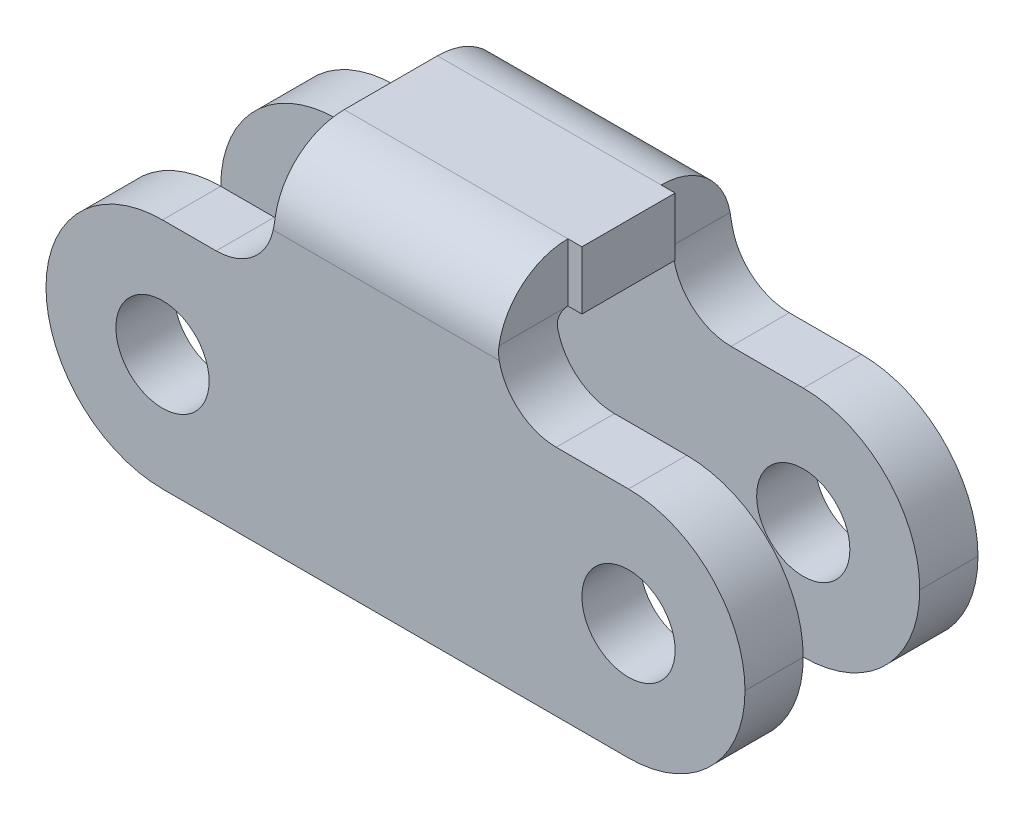
from build123d import *

# Parameters (mm, degrees)
SKETCH1_W           = 38.1
SKETCH1_H           = 19.05
SKETCH1_R           = 2.54
BASE_EXTRUDE_DEPTH  = 12.7
CUT_EXTRUDE1_DEPTH  = 43.121134838
CUT_EXTRUDE2_DEPTH  = 37.477972806
CUT_EXTRUDE3_DEPTH  = 37.477972806
FILLET1_R           = 0.635
FILLET2_R           = 3.81
FILLET3_R           = 6.35
SKETCH6_W           = 5.08
SKETCH6_H           = 3.175
BOSS_EXTRUDE1_DEPTH = 0.762


# Some blends are built 0.0001 mm under size
with BuildPart() as part:
    # Sketch1 → Base-Extrude (new body)
    with BuildSketch(Plane.XY):
        with Locations((12.7, 3.175)):
            Rectangle(SKETCH1_W, SKETCH1_H)
        Circle(SKETCH1_R, mode=Mode.SUBTRACT)
        with Locations((25.4, 0)):
            Circle(SKETCH1_R, mode=Mode.SUBTRACT)
    extrude(amount=-BASE_EXTRUDE_DEPTH)

    # Sketch3 → Cut-Extrude1 (cut, through all)
    with BuildSketch(Plane(origin=(31.75, 0, 0), x_dir=(0, 0, -1), z_dir=(1, 0, 0))):
        Polygon((3.175, -58.947094971), (3.175, -6.35), (3.175, 9.525), (9.525, 9.525), (9.525, -6.35), (9.525, -58.947094971), (9.525, -164.141284914), (3.175, -164.141284914), align=None)
    extrude(amount=-CUT_EXTRUDE1_DEPTH, mode=Mode.SUBTRACT)

    # Sketch4 → Cut-Extrude2 (cut, through all)
    with BuildSketch(Plane.XY):
        with BuildLine():
            Line((-96.671852568, 6.35), (-6.35, 6.35))
            Line((-6.35, 6.35), (2.921, 6.35))
            ThreePointArc((2.921, 6.35), (5.16606403, 7.27993597), (6.096, 9.525))
            Line((6.096, 9.525), (6.096, 12.7))
            Line((6.096, 12.7), (6.096, 103.021852568))
            Line((6.096, 103.021852568), (-117.676302849, 234.599074203))
            Line((-117.676302849, 234.599074203), (-220.444155417, 137.927221634))
            Line((-220.444155417, 137.927221634), (-96.671852568, 6.35))
        make_face()
    extrude(amount=-CUT_EXTRUDE2_DEPTH, mode=Mode.SUBTRACT)

    # Sketch5 → Cut-Extrude3 (cut, through all)
    with BuildSketch(Plane.XY):
        with BuildLine():
            Line((122.071852568, 6.35), (31.75, 6.35))
            Line((31.75, 6.35), (21.463, 6.35))
            ThreePointArc((21.463, 6.35), (19.21793597, 7.27993597), (18.288, 9.525))
            Line((18.288, 9.525), (18.288, 12.7))
            Line((18.288, 12.7), (18.288, 103.021852568))
            Line((18.288, 103.021852568), (141.41301137, 235.20498228))
            Line((141.41301137, 235.20498228), (245.196863939, 138.533129712))
            Line((245.196863939, 138.533129712), (122.071852568, 6.35))
        make_face()
    extrude(amount=-CUT_EXTRUDE3_DEPTH, mode=Mode.SUBTRACT)

    # Fillet1
    # the kernel refuses this fillet: 0.635 mm, written as the material it adds along each edge
    with BuildSketch(Plane(origin=(19.8755, 9.525, -9.525), x_dir=(0, 0, 1), z_dir=(-1, 0, 0))) as fillet1_piece_1_section:
        with BuildLine():
            CenterArc((FILLET1_R, -FILLET1_R), FILLET1_R, 90, 90)
            Line((0, -FILLET1_R), (0, 0))
            Line((0, 0), (FILLET1_R, 0))
        make_face()
    fillet1_piece_1 = extrude(amount=15.367, mode=Mode.PRIVATE)
    fillet1_piece_1 = fillet1_piece_1 - Plane(origin=(2.921, 9.525, -9.486385911), x_dir=(0, -1, 0), z_dir=(0, 0, 1)) * Cylinder(3.175, 34, mode=Mode.PRIVATE)
    fillet1_piece_1 = fillet1_piece_1 - Plane(origin=(21.463, 9.525, -9.486385911), x_dir=(0, -1, 0), z_dir=(0, 0, 1)) * Cylinder(3.175, 34, mode=Mode.PRIVATE)
    add(fillet1_piece_1)
    with BuildSketch(Plane(origin=(19.8755, 9.525, -3.175), x_dir=(0, -1, 0), z_dir=(-1, 0, 0))) as fillet1_piece_2_section:
        with BuildLine():
            CenterArc((FILLET1_R, -FILLET1_R), FILLET1_R, 90, 90)
            Line((0, -FILLET1_R), (0, 0))
            Line((0, 0), (FILLET1_R, 0))
        make_face()
    fillet1_piece_2 = extrude(amount=15.367, mode=Mode.PRIVATE)
    fillet1_piece_2 = fillet1_piece_2 - Plane(origin=(21.463, 9.525, -3.21361614), x_dir=(0, -1, 0), z_dir=(0, 0, 1)) * Cylinder(3.175, 34, mode=Mode.PRIVATE)
    fillet1_piece_2 = fillet1_piece_2 - Plane(origin=(2.921, 9.525, -3.21361614), x_dir=(0, -1, 0), z_dir=(0, 0, 1)) * Cylinder(3.175, 34, mode=Mode.PRIVATE)
    add(fillet1_piece_2)

    # Fillet2
    fillet2_edges = [part.edges().sort_by_distance(p)[0] for p in [
        (12.192, 12.7, 0),
        (12.192, 12.7, -12.7),
    ]]
    fillet(fillet2_edges, radius=FILLET2_R)

    # Fillet3
    fillet3_edges = [part.edges().sort_by_distance(p)[0] for p in [
        (-6.35, -6.35, -1.5875),
        (31.75, -6.35, -1.5875),
        (-6.35, 6.35, -1.5875),
        (-6.35, 6.35, -11.1125),
        (31.75, 6.35, -11.1125),
        (-6.35, -6.35, -11.1125),
        (31.75, 6.35, -1.5875),
        (31.75, -6.35, -11.1125),
    ]]
    fillet(fillet3_edges, radius=FILLET3_R - 0.0001)  # a hair under: the kernel refuses the full size

    # Sketch6 → Boss-Extrude1 (add)
    with BuildSketch(Plane(origin=(18.288, 0, 0), x_dir=(0, 0, -1), z_dir=(1, 0, 0))):
        with Locations((6.35, 11.1125)):
            Rectangle(SKETCH6_W, SKETCH6_H)
    extrude(amount=BOSS_EXTRUDE1_DEPTH)


solid = part.part
